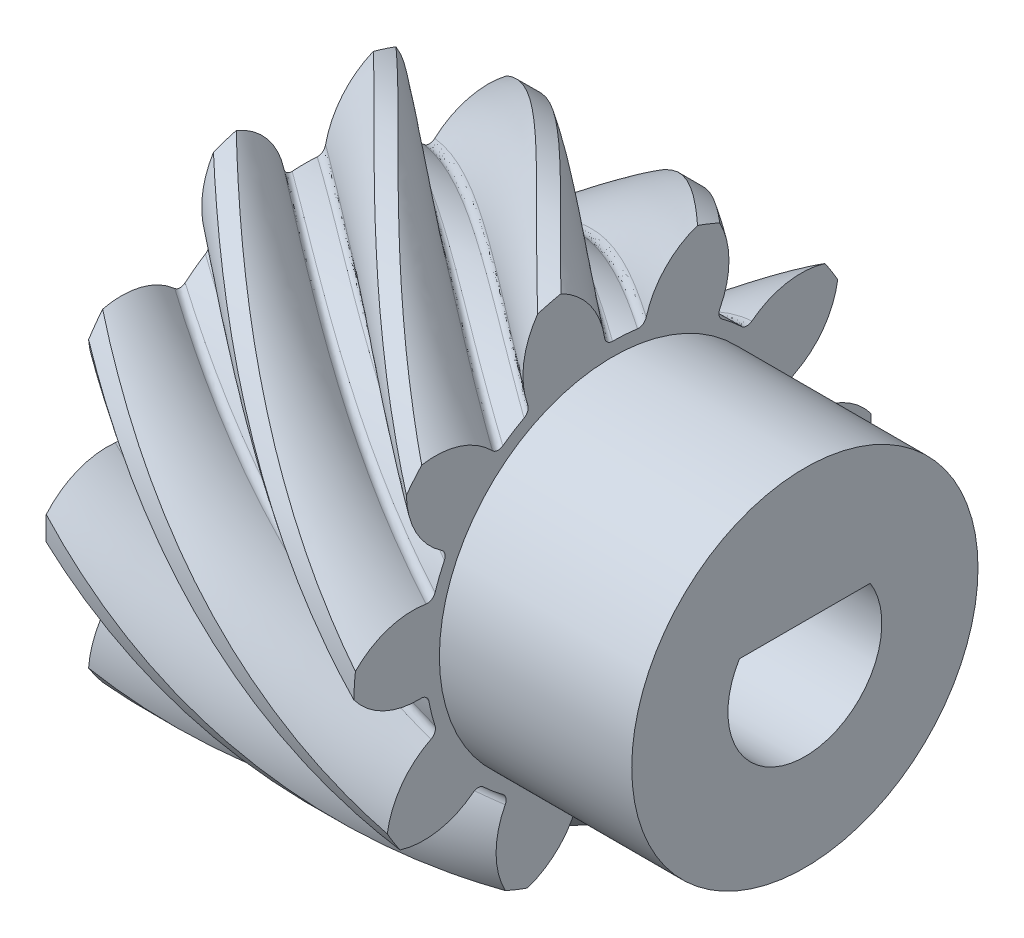
from build123d import *

# Parameters (mm, degrees)
BASPROSKE_W            = 10.16
BASPROSKE_H            = 8.541880101
TOOTHCUTRH_PITCH       = 53.670215546
TOOTHCUTRH_HEIGHT      = 10.16
TOOTHCUTRH_RADIUS      = 8.541880101
TOOTHCUTRH_START_ANGLE = -90
TEETHCUTSRH_COUNT      = 10
TEETHCUTSRH_ANGLE      = 324
BORSKE_R               = 0.396875
BORE_DEPTH             = 50.8000508
SKETCH3_R              = 5.715
BOSS_EXTRUDE1_DEPTH    = 6.35
CUT_EXTRUDE1_DEPTH     = 21.457456703


with BuildPart() as part:
    # BasProSke → Base-Revolve (revolve)
    with BuildSketch(Plane(origin=(0, 0, 0), x_dir=(1, 0, 0), z_dir=(0, 1, 0)), mode=Mode.PRIVATE) as base_revolve_sk:
        with Locations((5.08, 4.270940051)):
            Rectangle(BASPROSKE_W, BASPROSKE_H)
    revolve(base_revolve_sk.sketch.rotate(Axis((-10, 0, 0), (1, 0, 0)), 180), axis=Axis((-10, 0, 0), (1, 0, 0)))

    # ToothCutRH: sweep along a helix
    with BuildLine() as toothcutrh_path:
        add(Helix(TOOTHCUTRH_PITCH, TOOTHCUTRH_HEIGHT, TOOTHCUTRH_RADIUS, center=(0, 0, 0), direction=(1, 0, 0), mode=Mode.PRIVATE).rotate(Axis((0, 0, 0), (1, 0, 0)), TOOTHCUTRH_START_ANGLE))
    # TooCutSkeRH → ToothCutRH (sweep, cut)
    with BuildSketch(Plane(origin=(0, 0, 0), x_dir=(0, 0, -1), z_dir=(1, 0, 0))):
        with BuildLine():
            ThreePointArc((0.413604393, 6.146730403), (0, 6.160630101), (-0.413604393, 6.146730403))
            ThreePointArc((-0.413604393, 6.146730403), (-0.589047936, 6.198888789), (-0.687741681, 6.353033133))
            ThreePointArc((-0.687741681, 6.353033133), (-1.396442535, 7.657438993), (-2.696068011, 8.374868549))
            ThreePointArc((-2.696068011, 8.374868549), (0, 8.798136504), (2.696068011, 8.374868549))
            ThreePointArc((2.696068011, 8.374868549), (1.396442535, 7.657438993), (0.687741681, 6.353033133))
            ThreePointArc((0.687741681, 6.353033133), (0.589047936, 6.198888789), (0.413604393, 6.146730403))
        make_face()
    toothcutrh = sweep(path=toothcutrh_path.line, is_frenet=True, mode=Mode.SUBTRACT)

    # TeethCutsRH: ToothCutRH ×10 about axis
    teethcutsrh_axis = Axis((-10, 0, 0), (1, 0, 0))
    for i in range(1, TEETHCUTSRH_COUNT):
        add(toothcutrh.rotate(teethcutsrh_axis, i * TEETHCUTSRH_ANGLE / (TEETHCUTSRH_COUNT - 1)), mode=Mode.SUBTRACT)

    # BorSke → Bore (cut, symmetric)
    with BuildSketch(Plane(origin=(0, 0, 0), x_dir=(0, 0, -1), z_dir=(1, 0, 0))):
        with Locations(Location((0, 0, 0), (0, 0, 180))):
            Circle(BORSKE_R)
    extrude(amount=BORE_DEPTH, both=True, mode=Mode.SUBTRACT)

    # Sketch3 → Boss-Extrude1 (add)
    with BuildSketch(Plane(origin=(10.16, 0, 0), x_dir=(0, 0, -1), z_dir=(1, 0, 0))):
        with Locations(Location((0, 0, 0), (0, 0, 180))):
            Circle(SKETCH3_R)
    extrude(amount=BOSS_EXTRUDE1_DEPTH)

    # Sketch4 → Cut-Extrude1 (cut, through all)
    with BuildSketch(Plane.ZY):
        with BuildLine():
            Line((2.159, 1.338028027), (-2.159, 1.338028027))
            ThreePointArc((-2.159, 1.338028027), (0, -2.54), (2.159, 1.338028027))
        make_face()
    extrude(amount=-CUT_EXTRUDE1_DEPTH, mode=Mode.SUBTRACT)


solid = part.part
